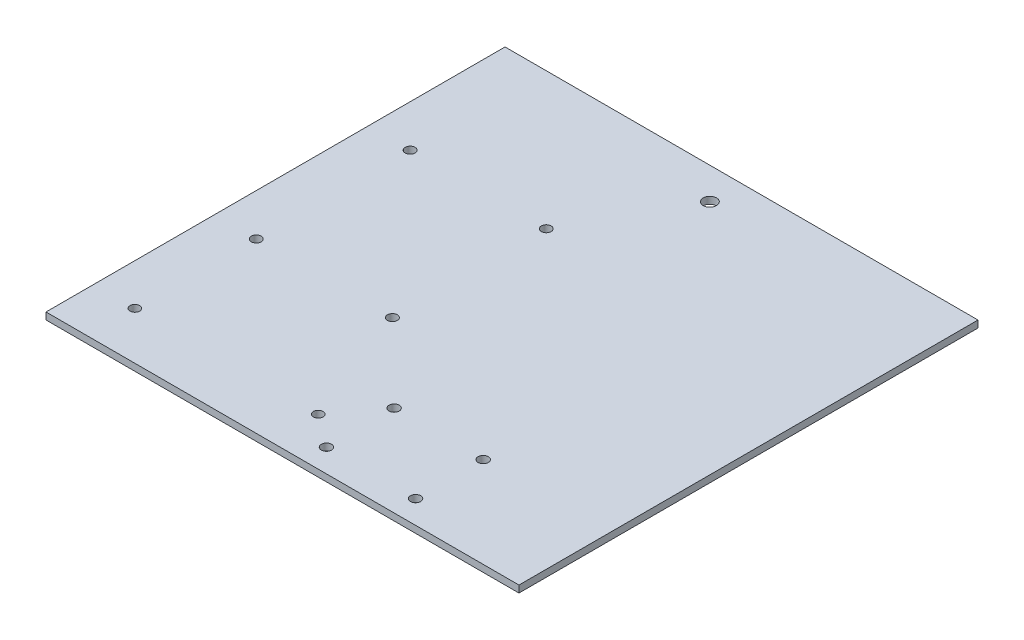
from build123d import *

# Parameters (mm, degrees)
SKETCH1_W           = 189.738
SKETCH1_H           = 184.15
BOSS_EXTRUDE1_DEPTH = 2.794
SKETCH2_R           = 2.6797
CUT_EXTRUDE1_DEPTH  = 133.233653893
SKETCH4_R           = 1.936199963
SKETCH4_R_2         = 2.048699992
SKETCH4_R_3         = 1.98
CUT_EXTRUDE3_DEPTH  = 133.233653893


with BuildPart() as part:
    # Sketch1 → Boss-Extrude1 (new body)
    with BuildSketch(Plane(origin=(0, 0, 0), x_dir=(1, 0, 0), z_dir=(0, 1, 0))):
        Rectangle(SKETCH1_W, SKETCH1_H)
    extrude(amount=BOSS_EXTRUDE1_DEPTH)

    # Sketch2 → Cut-Extrude1 (cut, through all)
    with BuildSketch(Plane(origin=(0, 2.794, 0), x_dir=(1, 0, 0), z_dir=(0, 1, 0))):
        with Locations((0, 79.375)):
            Circle(SKETCH2_R)
    extrude(amount=-CUT_EXTRUDE1_DEPTH, mode=Mode.SUBTRACT)

    # Sketch4 → Cut-Extrude3 (cut, through all)
    with BuildSketch(Plane(origin=(0, 2.794, 0), x_dir=(1, 0, 0), z_dir=(0, 1, 0))):
        with Locations((-78.2965, -72.992499938)):
            Circle(SKETCH4_R)
        with Locations((-4.7415, -72.9925)):
            Circle(SKETCH4_R)
        with Locations((8.356, -55.65)):
            Circle(SKETCH4_R_2)
        with Locations((44.106, -55.65)):
            Circle(SKETCH4_R_2)
        with Locations((44.106, -82.8)):
            Circle(SKETCH4_R_2)
        with Locations((8.356, -82.8)):
            Circle(SKETCH4_R_2)
        with Locations((-78.039, 37.175)):
            Circle(SKETCH4_R_3)
        with Locations((-23.429, 37.175)):
            Circle(SKETCH4_R_3)
        with Locations((-23.429, -24.545)):
            Circle(SKETCH4_R_3)
        with Locations((-78.039, -24.545)):
            Circle(SKETCH4_R_3)
    extrude(amount=-CUT_EXTRUDE3_DEPTH, mode=Mode.SUBTRACT)


solid = part.part
